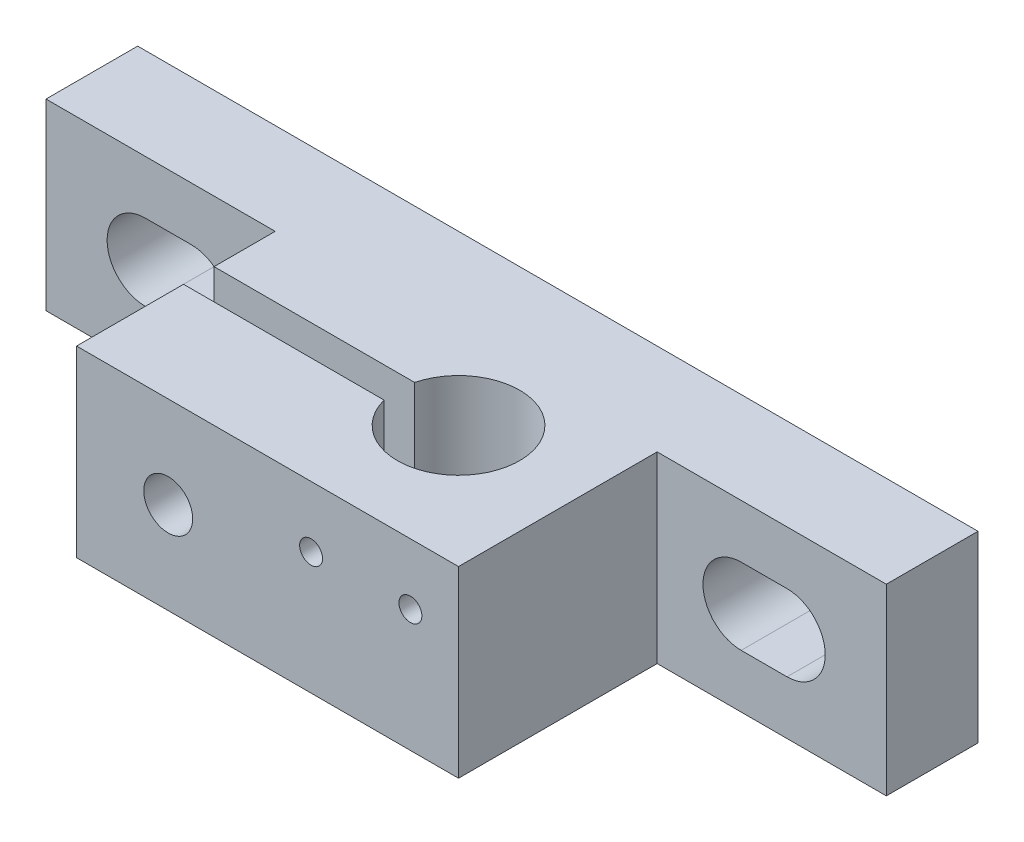
from build123d import *

# Parameters (mm, degrees)
SKETCH2_W           = 55
SKETCH2_H           = 12
BOSS_EXTRUDE1_DEPTH = 6
SKETCH3_W           = 25
SKETCH3_H           = 12
BOSS_EXTRUDE2_DEPTH = 13
CUT_EXTRUDE2_DEPTH  = 30
SKETCH5_W           = 20.513890507
SKETCH5_H           = 7
CUT_EXTRUDE3_DEPTH  = 5
SKETCH6_R           = 1.6
CUT_EXTRUDE4_DEPTH  = 20
CUT_EXTRUDE5_DEPTH  = 3
SKETCH8_R           = 0.75
CUT_EXTRUDE6_DEPTH  = 3


with BuildPart() as part:
    # Sketch2 → Boss-Extrude1 (new body)
    with BuildSketch(Plane.XY):
        with Locations((27.5, 6)):
            Rectangle(SKETCH2_W, SKETCH2_H)
        with BuildLine():
            Line((6.5, 8.5), (9.5, 8.5))
            ThreePointArc((9.5, 8.5), (12, 6), (9.5, 3.5))
            Line((9.5, 3.5), (6.5, 3.5))
            ThreePointArc((6.5, 3.5), (4, 6), (6.5, 8.5))
        make_face(mode=Mode.SUBTRACT)
        with BuildLine():
            Line((48.5, 8.5), (45.5, 8.5))
            ThreePointArc((45.5, 8.5), (43, 6), (45.5, 3.5))
            Line((45.5, 3.5), (48.5, 3.5))
            ThreePointArc((48.5, 3.5), (51, 6), (48.5, 8.5))
        make_face(mode=Mode.SUBTRACT)
    extrude(amount=BOSS_EXTRUDE1_DEPTH)

    # Sketch3 → Boss-Extrude2 (add)
    with BuildSketch(Plane.XY.offset(6)):
        with Locations((27.5, 6)):
            Rectangle(SKETCH3_W, SKETCH3_H)
    extrude(amount=BOSS_EXTRUDE2_DEPTH)

    # Sketch4 → Cut-Extrude2 (cut)
    with BuildSketch(Plane.XZ):
        with BuildLine():
            Line((15, 10), (28.127016654, 10))
            ThreePointArc((28.127016654, 10), (36, 11), (28.127016654, 12))
            Line((28.127016654, 12), (15, 12))
            Line((15, 12), (15, 10))
        make_face()
    extrude(amount=-CUT_EXTRUDE2_DEPTH, mode=Mode.SUBTRACT)

    # Sketch5 → Cut-Extrude3 (cut)
    with BuildSketch(Plane(origin=(0, 0, 0), x_dir=(-1, 0, 0), z_dir=(0, 0, -1))):
        with Locations((-27.415473723, 6)):
            Rectangle(SKETCH5_W, SKETCH5_H)
    extrude(amount=-CUT_EXTRUDE3_DEPTH, mode=Mode.SUBTRACT)

    # Sketch6 → Cut-Extrude4 (cut)
    with BuildSketch(Plane.XY.offset(19)):
        with Locations((21, 6)):
            Circle(SKETCH6_R)
    extrude(amount=-CUT_EXTRUDE4_DEPTH, mode=Mode.SUBTRACT)

    # Sketch7 → Cut-Extrude5 (cut)
    with BuildSketch(Plane(origin=(0, 0, 5), x_dir=(-1, 0, 0), z_dir=(0, 0, -1))):
        Polygon((-17.535898385, 6), (-19.267949192, 9), (-22.732050808, 9), (-24.464101615, 6), (-22.732050808, 3), (-19.267949192, 3), align=None)
    extrude(amount=-CUT_EXTRUDE5_DEPTH, mode=Mode.SUBTRACT)

    # Sketch8 → Cut-Extrude6 (cut)
    with BuildSketch(Plane.XY.offset(19)):
        with Locations((36.85, 8)):
            Circle(SKETCH8_R)
        with Locations((30.35, 8)):
            Circle(SKETCH8_R)
    extrude(amount=-CUT_EXTRUDE6_DEPTH, mode=Mode.SUBTRACT)


solid = part.part
